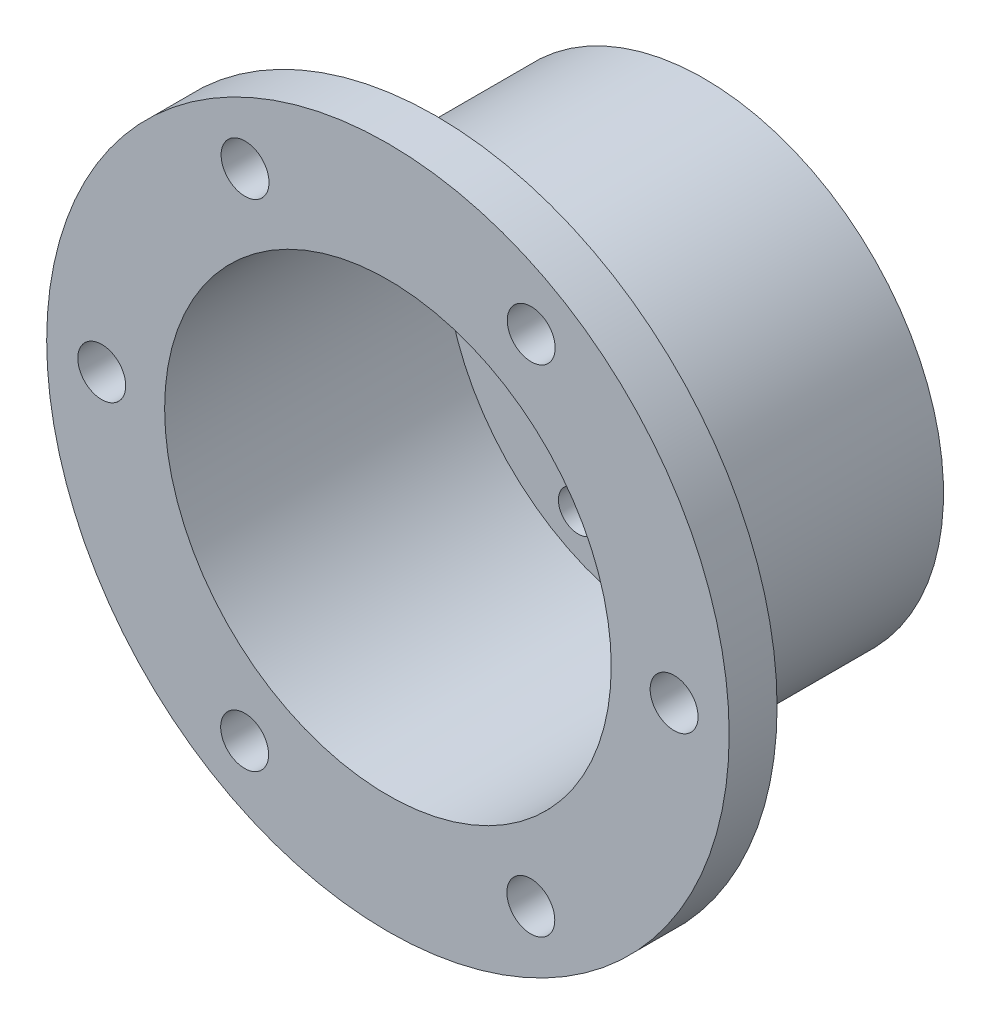
from build123d import *

# Parameters (mm, degrees)
CROQUIS1_R              = 21.4
CROQUIS1_R_2            = 18.65
SALIENTE_EXTRUIR1_DEPTH = 26.4
CROQUIS2_R              = 18.65
SALIENTE_EXTRUIR2_DEPTH = 3
SALIENTE_EXTRUIR3_START = -4
CROQUIS3_R              = 28.5
CROQUIS3_R_2            = 21.4
SALIENTE_EXTRUIR3_DEPTH = 4
CROQUIS4_R              = 6.15
CROQUIS4_R_2            = 1.65
CORTAR_EXTRUIR1_DEPTH   = 3
CROQUIS6_R              = 2
CORTAR_EXTRUIR2_DEPTH   = 49.181531732
CROQUIS7_R              = 21.4
CROQUIS7_R_2            = 20
CORTAR_EXTRUIR3_DEPTH   = 22.4


with BuildPart() as part:
    # Croquis1 → Saliente-Extruir1 (new body)
    with BuildSketch(Plane.XY):
        Circle(CROQUIS1_R)
        Circle(CROQUIS1_R_2, mode=Mode.SUBTRACT)
    extrude(amount=SALIENTE_EXTRUIR1_DEPTH)

    # Croquis2 → Saliente-Extruir2 (add)
    with BuildSketch(Plane(origin=(0, 0, 0), x_dir=(-1, 0, 0), z_dir=(0, 0, -1))):
        Circle(CROQUIS2_R)
    extrude(amount=-SALIENTE_EXTRUIR2_DEPTH)

    # Croquis3 → Saliente-Extruir3 (add)
    with BuildSketch(Plane.XY.offset(26.4).offset(SALIENTE_EXTRUIR3_START)):
        Circle(CROQUIS3_R)
        Circle(CROQUIS3_R_2, mode=Mode.SUBTRACT)
    extrude(amount=SALIENTE_EXTRUIR3_DEPTH)

    # Croquis4 → Cortar-Extruir1 (cut)
    with BuildSketch(Plane(origin=(0, 0, 0), x_dir=(-1, 0, 0), z_dir=(0, 0, -1))):
        with Locations((0, -7)):
            Circle(CROQUIS4_R)
        with Locations((-15.497639275, 0.2705123)):
            Circle(CROQUIS4_R_2)
        with Locations((-7.514549114, 13.556605461)):
            Circle(CROQUIS4_R_2)
        with Locations((7.983090161, 13.286093161)):
            Circle(CROQUIS4_R_2)
        with Locations((15.497639275, -0.2705123)):
            Circle(CROQUIS4_R_2)
        with Locations((7.514549114, -13.556605461)):
            Circle(CROQUIS4_R_2)
        with Locations((-7.983090161, -13.286093161)):
            Circle(CROQUIS4_R_2)
    extrude(amount=-CORTAR_EXTRUIR1_DEPTH, mode=Mode.SUBTRACT)

    # Croquis6 → Cortar-Extruir2 (cut, through all)
    with BuildSketch(Plane.XY.offset(26.4)):
        with Locations((11.96671541, 20.688356504)):
            Circle(CROQUIS6_R)
        with Locations((23.9, -0.019301293)):
            Circle(CROQUIS6_R)
        with Locations((-11.93328459, 20.707657797)):
            Circle(CROQUIS6_R)
        with Locations((11.93328459, -20.707657797)):
            Circle(CROQUIS6_R)
        with Locations((-11.96671541, -20.688356504)):
            Circle(CROQUIS6_R)
        with Locations((-23.9, 0.019301293)):
            Circle(CROQUIS6_R)
    extrude(amount=-CORTAR_EXTRUIR2_DEPTH, mode=Mode.SUBTRACT)

    # Croquis7 → Cortar-Extruir3 (cut)
    with BuildSketch(Plane(origin=(0, 0, 0), x_dir=(-1, 0, 0), z_dir=(0, 0, -1))):
        Circle(CROQUIS7_R)
        Circle(CROQUIS7_R_2, mode=Mode.SUBTRACT)
    extrude(amount=-CORTAR_EXTRUIR3_DEPTH, mode=Mode.SUBTRACT)


solid = part.part
